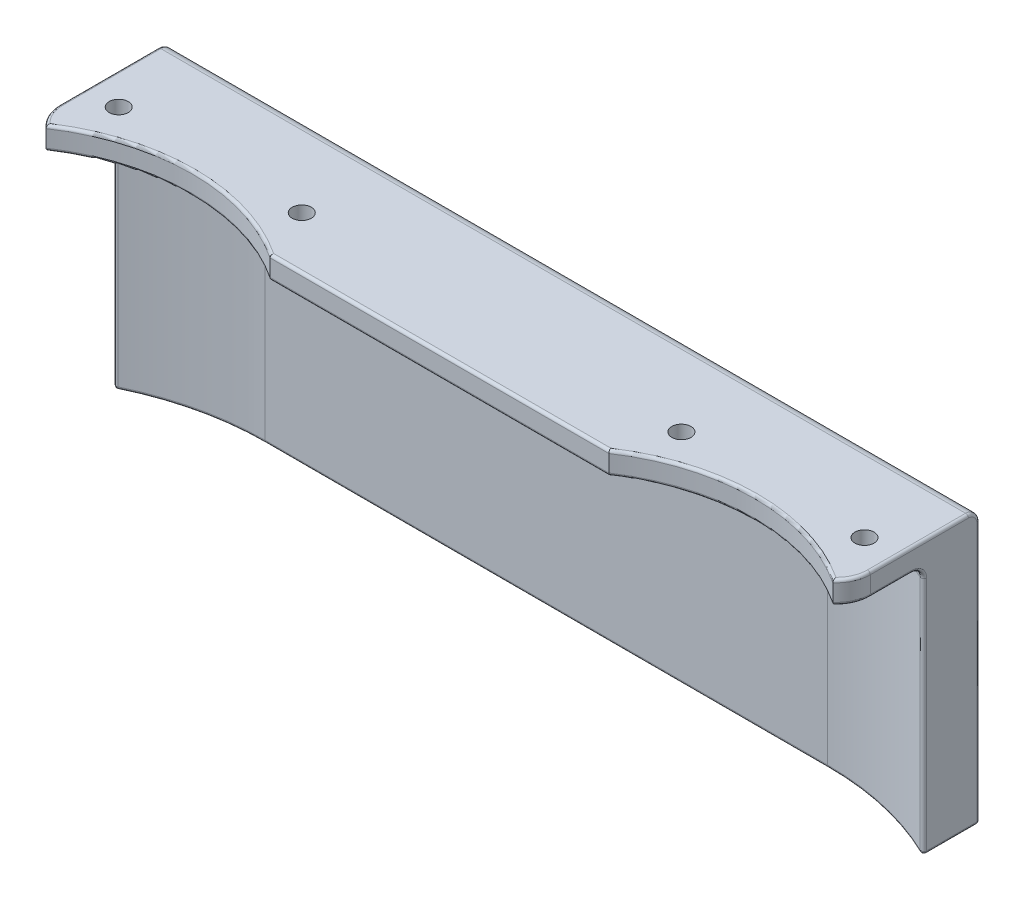
from build123d import *

# Parameters (mm, degrees)
BOSS_EXTRUDE1_DEPTH = 4
SKETCH3_W           = 144
SKETCH3_H           = 5
BOSS_EXTRUDE2_DEPTH = 44.5
SKETCH5_R           = 1.7
CUT_EXTRUDE1_DEPTH  = 4
BOSS_EXTRUDE3_DEPTH = 44.5
FILLET1_R           = 2
FILLET2_R           = 6
FILLET3_R           = 0.5


with BuildPart() as part:
    # Sketch2 → Boss-Extrude1 (new body)
    with BuildSketch(Plane(origin=(0, 0, 0), x_dir=(1, 0, 0), z_dir=(0, 1, 0))):
        with BuildLine():
            Line((72, 30), (72, 54))
            Line((72, 54), (-72, 54))
            Line((-72, 54), (-72, 30))
            Line((-72, 30), (-69.899748742, 30))
            ThreePointArc((-69.899748742, 30), (-50, 36), (-30.100251258, 30))
            Line((-30.100251258, 30), (30.100251258, 30))
            ThreePointArc((30.100251258, 30), (50, 36), (69.899748742, 30))
            Line((69.899748742, 30), (72, 30))
        make_face()
    extrude(amount=BOSS_EXTRUDE1_DEPTH)

    # Sketch3 → Boss-Extrude2 (add)
    with BuildSketch(Plane.XZ):
        with Locations((0, -51.5)):
            Rectangle(SKETCH3_W, SKETCH3_H)
    extrude(amount=BOSS_EXTRUDE2_DEPTH)

    # Sketch5 → Cut-Extrude1 (cut)
    with BuildSketch(Plane(origin=(0, 4, 0), x_dir=(1, 0, 0), z_dir=(0, 1, 0))):
        with Locations(Location((-66.264045876, 39.264880132, 0), (0, 0, 270))):
            Circle(SKETCH5_R)
        with Locations(Location((-33.735954124, 39.264880132, 0), (0, 0, 270))):
            Circle(SKETCH5_R)
        with Locations(Location((33.735954124, 39.264880132, 0), (0, 0, 270))):
            Circle(SKETCH5_R)
        with Locations(Location((66.264045876, 39.264880132, 0), (0, 0, 270))):
            Circle(SKETCH5_R)
    extrude(amount=-CUT_EXTRUDE1_DEPTH, mode=Mode.SUBTRACT)

    # Sketch6 → Boss-Extrude3 (add)
    with BuildSketch(Plane.XZ.offset(44.5)):
        with BuildLine():
            Line((72, -49), (72, -43.783558558))
            ThreePointArc((72, -43.783558558), (61.304990727, -47.678057686), (50, -49))
            Line((50, -49), (72, -49))
        make_face()
        with BuildLine():
            Line((-72, -49), (-50, -49))
            ThreePointArc((-50, -49), (-61.304990727, -47.678057686), (-72, -43.783558558))
            Line((-72, -43.783558558), (-72, -49))
        make_face()
    extrude(amount=-BOSS_EXTRUDE3_DEPTH)

    # Fillet1
    fillet1_edges = [part.edges().sort_by_distance(p)[0] for p in [
        (0, 4, -54),
        (0, 0, -49),
        (61.304990727, 0, -47.678057686),
        (-61.304990727, 0, -47.678057686),
    ]]
    fillet(fillet1_edges, radius=FILLET1_R)

    # Fillet2
    # the kernel refuses this fillet: 6 mm, written as the material it takes off along each edge
    with BuildSketch(Plane(origin=(-72, -11.399550361, -30), x_dir=(0, 0, -1), z_dir=(0, 1, 0))) as fillet2_piece_1:
        with BuildLine():
            CenterArc((4.559820144, -6), FILLET2_R, 90, 49.461555346)
            Line((0, -2.100251258), (-0.091196403, -2.022256283))
            ThreePointArc((-0.091196403, -2.022256283), (-0.12, -1.050125629), (-0.12, 0))
            Line((-0.12, 0), (0, 0.12))
            Line((0, 0.12), (4.559820144, 0.12))
            Line((4.559820144, 0.12), (4.559820144, 0))
        make_face()
    extrude(amount=26.799100721, mode=Mode.SUBTRACT)
    with BuildSketch(Plane(origin=(72, -11.399550361, -30), x_dir=(0, 0, -1), z_dir=(0, 1, 0))) as fillet2_piece_2:
        with BuildLine():
            CenterArc((4.559820144, 6), FILLET2_R, 220.538444654, 49.461555346)
            Line((0, 2.100251258), (-0.091196403, 2.022256283))
            ThreePointArc((-0.091196403, 2.022256283), (-0.12, 1.050125629), (-0.12, 0))
            Line((-0.12, 0), (0, -0.12))
            Line((0, -0.12), (4.559820144, -0.12))
            Line((4.559820144, -0.12), (4.559820144, 0))
        make_face()
    extrude(amount=26.799100721, mode=Mode.SUBTRACT)

    # Fillet3
    fillet3_edges = [part.edges().sort_by_distance(p)[0] for p in [
        (-50, 0, -36),
        (-50, 4, -36),
        (0, 4, -30),
        (50, 4, -36),
        (72, -44.5, -48.891779279),
        (-72, -44.5, -48.891779279),
        (0, -44.5, -54),
        (0, -44.5, -49),
        (61.304990727, -44.5, -47.678057686),
        (-61.304990727, -44.5, -47.678057686),
        (-72, 0, -38.046469729),
        (72, -23.25, -43.783558558),
        (-72, -23.25, -43.783558558),
        (-72, 4, -43.279910072),
        (-72, -21.25, -54),
        (-72, 3.414213562, -53.414213562),
        (72, -21.25, -54),
        (72, 3.414213562, -53.414213562),
        (72, -0.543612491, -43.078170154),
        (-72, -0.543612491, -43.078170154),
        (50, 0, -36),
        (72, 0, -38.046469729),
        (71.44970148, 0, -32.049689914),
        (-71.44970148, 0, -32.049689914),
        (0, 0, -30),
        (72, 4, -43.279910072),
        (71.44970148, 4, -32.049689914),
        (-71.44970148, 4, -32.049689914),
    ]]
    fillet(fillet3_edges, radius=FILLET3_R)


solid = part.part
